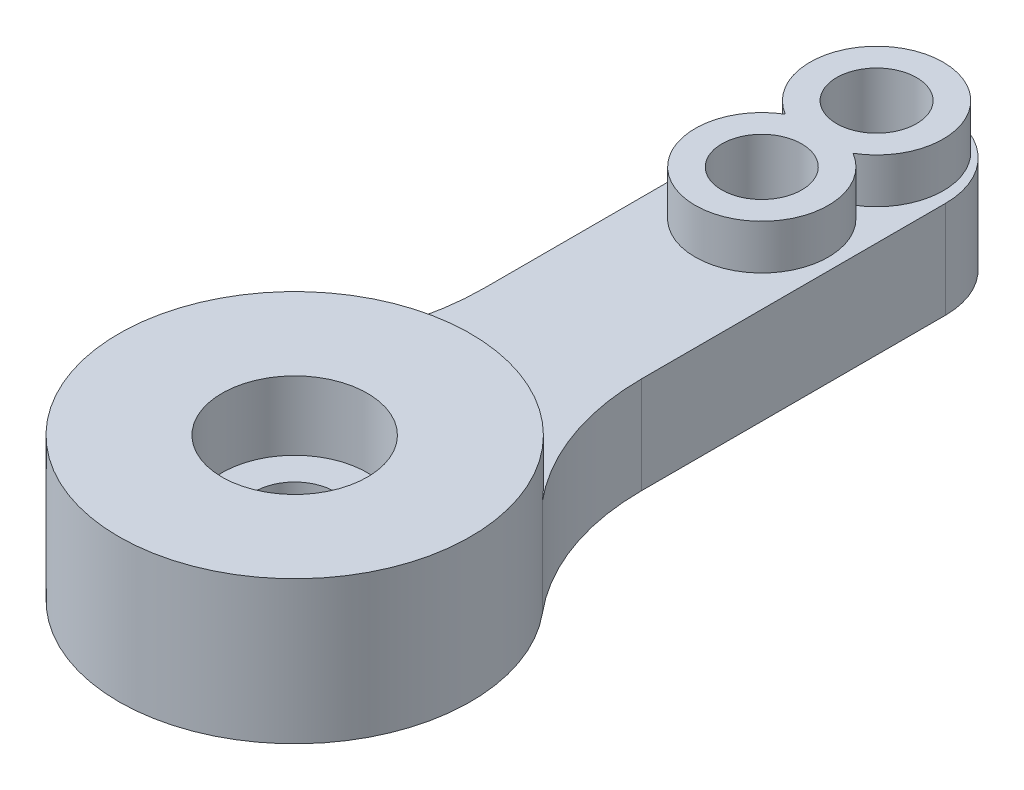
from build123d import *

# Parameters (mm, degrees)
BOSS_EXTRU_1_DEPTH           = 4
ESQUISSE3_R                  = 7.26
BOSS_EXTRU_2_DEPTH           = 1.9
ENL_V_MAT_EXTRU_1_DEPTH      = 29.119468345
ENL_V_MAT_EXTRU_1_DEPTH_BACK = 29.119468345
ESQUISSE2_R                  = 1.65
BOSS_EXTRU_3_START           = 1.85
ESQUISSE4_R                  = 1.65
BOSS_EXTRU_3_DEPTH           = 1.85
CONG_1_R                     = 10
ESQUISSE5_R                  = 3
ENL_V_MAT_EXTRU_2_DEPTH      = 2.84


with BuildPart() as part:
    # Esquisse1 → Boss.-Extru.1 (new body)
    with BuildSketch(Plane(origin=(0, 0, 0), x_dir=(1, 0, 0), z_dir=(0, 1, 0))):
        with BuildLine():
            Line((-3.245, 6.494426457), (-3.245, 23.625))
            ThreePointArc((-3.245, 23.625), (0, 26.87), (3.245, 23.625))
            Line((3.245, 23.625), (3.245, 6.494426457))
            ThreePointArc((3.245, 6.494426457), (0, -7.26), (-3.245, 6.494426457))
        make_face()
    extrude(amount=BOSS_EXTRU_1_DEPTH)

    # Esquisse3 → Boss.-Extru.2 (add)
    with BuildSketch(Plane(origin=(0, 4, 0), x_dir=(1, 0, 0), z_dir=(0, 1, 0))):
        with Locations(Location((0, 0, 0), (0, 0, 63.450571564))):
            Circle(ESQUISSE3_R)
    extrude(amount=BOSS_EXTRU_2_DEPTH)

    # Esquisse2 → Enlèv. mat.-Extru.1 (cut, two sides: drawn at the far end of the back side and taken through both)
    with BuildSketch(Plane(origin=(0, 4, 0), x_dir=(1, 0, 0), z_dir=(0, 1, 0)).offset(-ENL_V_MAT_EXTRU_1_DEPTH_BACK)):
        with Locations(Location((0, 0, 0), (0, 0, 270))):
            Circle(ESQUISSE2_R)
        with Locations(Location((0, 19.28, 0), (0, 0, 270))):
            Circle(ESQUISSE2_R)
        with Locations(Location((0, 24.02, 0), (0, 0, 270))):
            Circle(ESQUISSE2_R)
    extrude(amount=ENL_V_MAT_EXTRU_1_DEPTH + ENL_V_MAT_EXTRU_1_DEPTH_BACK, mode=Mode.SUBTRACT)

    # Esquisse4 → Boss.-Extru.3 (add)
    with BuildSketch(Plane(origin=(0, 4, 0), x_dir=(1, 0, 0), z_dir=(0, 1, 0)).offset(BOSS_EXTRU_3_START)):
        with BuildLine():
            ThreePointArc((1.394847662, 21.65), (0, 26.77), (-1.394847662, 21.65))
            ThreePointArc((-1.394847662, 21.65), (0, 16.53), (1.394847662, 21.65))
        make_face()
        with Locations(Location((0, 24.02, 0), (0, 0, 270))):
            Circle(ESQUISSE4_R, mode=Mode.SUBTRACT)
        with Locations(Location((0, 19.28, 0), (0, 0, 270))):
            Circle(ESQUISSE4_R, mode=Mode.SUBTRACT)
    extrude(amount=-BOSS_EXTRU_3_DEPTH)

    # Congé1
    # the kernel refuses this fillet: 10 mm, written as the material it adds along each edge
    with BuildSketch(Plane(origin=(3.245, 0, -6.494426457), x_dir=(0, 0, -1), z_dir=(0, 1, 0))) as cong_1_piece_1:
        with BuildLine():
            CenterArc((4.572532249, -10), CONG_1_R, 90, 39.880695656)
            ThreePointArc((-1.839378936, -2.326187717), (-0.799649919, -1.258012346), (0, 0))
            Line((0, 0), (4.572532249, 0))
        make_face()
    extrude(amount=4)
    with BuildSketch(Plane(origin=(-3.245, 0, -6.494426457), x_dir=(0, 0, -1), z_dir=(0, 1, 0))) as cong_1_piece_2:
        with BuildLine():
            CenterArc((4.572532249, 10), CONG_1_R, 230.119304344, 39.880695656)
            ThreePointArc((-1.839378936, 2.326187717), (-0.799649919, 1.258012346), (0, 0))
            Line((0, 0), (4.572532249, 0))
        make_face()
    extrude(amount=4)

    # Esquisse5 → Enlèv. mat.-Extru.2 (cut)
    with BuildSketch(Plane(origin=(0, 5.9, 0), x_dir=(1, 0, 0), z_dir=(0, 1, 0))):
        with Locations(Location((0, 0, 0), (0, 0, 270))):
            Circle(ESQUISSE5_R)
    extrude(amount=-ENL_V_MAT_EXTRU_2_DEPTH, mode=Mode.SUBTRACT)


solid = part.part
